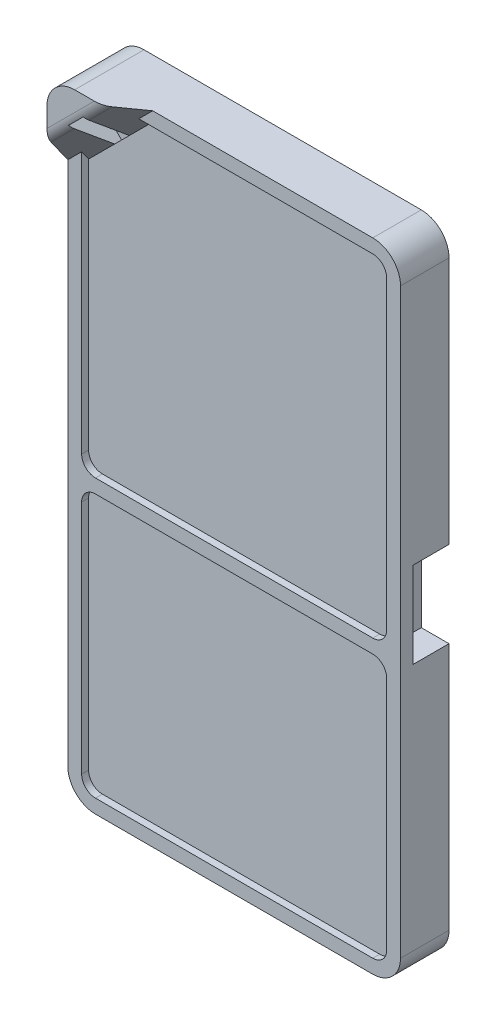
from build123d import *

# Parameters (mm, degrees)
BASE_DEPTH                = 3
CORNER_MARK_DEPTH         = 4.5
CORNER_MARK_DEPTH_BACK    = 4.5
CORNER_SKETCH_3_W         = 2
CORNER_SKETCH_3_H         = 0.5
CORNER_MARK_CUTOUT_DEPTH  = 0.75
CORNER_FIT_CUT_DEPTH      = 32.616432581
CORNER_FIT_CUT_DEPTH_BACK = 32.616432581
BORDER_START              = -3
BORDER_DEPTH              = 3.5
BODY_MIRROR_START         = -3
BODY_MIRROR_DEPTH         = 3
BODY_MIRROR_2_DEPTH       = 0.5
MAGNET_CUTOUT_SKETCH_W    = 2.6
MAGNET_CUTOUT_SKETCH_H    = 6.2
MAGNET_CUTOUT_DEPTH       = 2


with BuildPart() as part:
    # base_sketch → base (new body)
    with BuildSketch(Plane.XY):
        with BuildLine():
            ThreePointArc((-10, 0), (-10.707106781, 0.292893219), (-11, 1))
            Line((-11, 1), (-11, 23))
            ThreePointArc((-11, 23), (-10.707106781, 23.707106781), (-10, 24))
            Line((-10, 24), (0, 24))
            Line((0, 24), (0, 0))
            Line((0, 0), (-10, 0))
        make_face()
        with BuildLine():
            Line((0, -1), (-10, -1))
            ThreePointArc((-10, -1), (-10.707106781, -1.292893219), (-11, -2))
            Line((-11, -2), (-11, -19))
            ThreePointArc((-11, -19), (-10.707106781, -19.707106781), (-10, -20))
            Line((-10, -20), (0, -20))
            Line((0, -20), (0, -1))
        make_face()
        with BuildLine():
            Line((-10, 0), (0, 0))
            Line((0, 0), (0, -1))
            Line((0, -1), (-10, -1))
            ThreePointArc((-10, -1), (-10.707106781, -1.292893219), (-11, -2))
            Line((-11, -2), (-11, -19))
            ThreePointArc((-11, -19), (-10.707106781, -19.707106781), (-10, -20))
            Line((-10, -20), (0, -20))
            Line((0, -20), (0, -21))
            Line((0, -21), (-10, -21))
            ThreePointArc((-10, -21), (-11.414213562, -20.414213562), (-12, -19))
            Line((-12, -19), (-12, 23))
            ThreePointArc((-12, 23), (-11.414213562, 24.414213562), (-10, 25))
            Line((-10, 25), (0, 25))
            Line((0, 25), (0, 24))
            Line((0, 24), (-10, 24))
            ThreePointArc((-10, 24), (-10.707106781, 23.707106781), (-11, 23))
            Line((-11, 23), (-11, 1))
            ThreePointArc((-11, 1), (-10.707106781, 0.292893219), (-10, 0))
        make_face()
    extrude(amount=-BASE_DEPTH)

    # corner_sketch → corner_mark (add, two sides: drawn at the far end of the back side and taken through both)
    with BuildSketch(Plane(origin=(6.5, 6.5, 0), x_dir=(0.7071067811865477, -0.7071067811865475, 0), z_dir=(0.7071067811865475, 0.7071067811865477, 0)).offset(-CORNER_MARK_DEPTH_BACK)):
        with BuildLine():
            Line((-23.334523779, 0), (-25.334523779, 0))
            Line((-25.334523779, 0), (-25.334523779, -2))
            Line((-25.334523779, -2), (-23.748737342, -2))
            ThreePointArc((-23.748737342, -2), (-23.536817216, -1.97728699), (-23.334523779, -1.910179721))
            Line((-23.334523779, -1.910179721), (-23.334523779, 0))
        make_face()
        with BuildLine():
            Line((-21.334523779, 0), (-23.334523779, 0))
            Line((-23.334523779, 0), (-23.334523779, -1.910179721))
            ThreePointArc((-23.334523779, -1.910179721), (-23.178957136, -1.821797126), (-23.04163056, -1.707106781))
            Line((-23.04163056, -1.707106781), (-21.334523779, 0))
        make_face()
    extrude(amount=CORNER_MARK_DEPTH + CORNER_MARK_DEPTH_BACK)

    # corner_sketch<3> → corner_mark_cutout (cut, symmetric)
    with BuildSketch(Plane(origin=(6.5, 6.5, 0), x_dir=(0.7071067811865477, -0.7071067811865475, 0), z_dir=(0.7071067811865475, 0.7071067811865477, 0))):
        with BuildLine():
            Line((-21.334523779, 0), (-23.334523779, 0))
            Line((-23.334523779, 0), (-23.334523779, -1.910179721))
            ThreePointArc((-23.334523779, -1.910179721), (-23.178957136, -1.821797126), (-23.04163056, -1.707106781))
            Line((-23.04163056, -1.707106781), (-21.334523779, 0))
        make_face()
        with Locations((-22.334523779, 0.25)):
            Rectangle(CORNER_SKETCH_3_W, CORNER_SKETCH_3_H)
    extrude(amount=CORNER_MARK_CUTOUT_DEPTH, both=True, mode=Mode.SUBTRACT)

    # Эскиз3 → corner_fit_cut (cut, two sides: drawn at the far end of the back side and taken through both)
    with BuildSketch(Plane(origin=(0, 0, -3), x_dir=(-1, 0, 0), z_dir=(0, 0, -1)).offset(-CORNER_FIT_CUT_DEPTH_BACK)):
        with BuildLine():
            Line((10, 25), (4.949214827, 25))
            Line((4.949214827, 25), (4.949214827, 29.369186308))
            Line((4.949214827, 29.369186308), (15.830436382, 29.369186308))
            Line((15.830436382, 29.369186308), (15.830436382, 18.313069579))
            Line((15.830436382, 18.313069579), (12, 18.313069579))
            Line((12, 18.313069579), (12, 23))
            ThreePointArc((12, 23), (11.414213562, 24.414213562), (10, 25))
        make_face()
    extrude(amount=CORNER_FIT_CUT_DEPTH + CORNER_FIT_CUT_DEPTH_BACK, mode=Mode.SUBTRACT)

    # border: read off the stored shape, not the designer's step
    # border outline → border (add)
    with BuildSketch(Plane.XY.offset(BORDER_START)):
        Polygon((0, 24), (0, 25), (-5.878679656, 25), (-6.878679656, 24), align=None)
        with BuildLine():
            ThreePointArc((-10, 0), (-10.707106781, 0.292893219), (-11, 1))
            Line((-11, 1), (-11, 19.878679656))
            Line((-11, 19.878679656), (-12, 18.878679656))
            Line((-12, 18.878679656), (-12, -19))
            ThreePointArc((-12, -19), (-11.414213562, -20.414213562), (-10, -21))
            Line((-10, -21), (0, -21))
            Line((0, -21), (0, -20))
            Line((0, -20), (-10, -20))
            ThreePointArc((-10, -20), (-10.707106781, -19.707106781), (-11, -19))
            Line((-11, -19), (-11, -2))
            ThreePointArc((-11, -2), (-10.707106781, -1.292893219), (-10, -1))
            Line((-10, -1), (0, -1))
            Line((0, -1), (0, 0))
            Line((0, 0), (-10, 0))
        make_face()
    extrude(amount=BORDER_DEPTH)

    # body_mirror: read off the stored shape, not the designer's step
    # body_mirror outline → body_mirror (add)
    with BuildSketch(Plane.XY.offset(BODY_MIRROR_START)):
        with BuildLine():
            Line((0, -21), (10, -21))
            ThreePointArc((10, -21), (11.414213562, -20.414213562), (12, -19))
            Line((12, -19), (12, 23))
            ThreePointArc((12, 23), (11.414213562, 24.414213562), (10, 25))
            Line((10, 25), (0, 25))
            Line((0, 25), (0, -21))
        make_face()
    extrude(amount=BODY_MIRROR_DEPTH)

    # body_mirror 2 outline → body_mirror 2 (add)
    with BuildSketch(Plane.XY):
        with BuildLine():
            Line((0, -20), (0, -21))
            Line((0, -21), (10, -21))
            ThreePointArc((10, -21), (11.414213562, -20.414213562), (12, -19))
            Line((12, -19), (12, 23))
            ThreePointArc((12, 23), (11.414213562, 24.414213562), (10, 25))
            Line((10, 25), (0, 25))
            Line((0, 25), (0, 24))
            Line((0, 24), (10, 24))
            ThreePointArc((10, 24), (10.707106781, 23.707106781), (11, 23))
            Line((11, 23), (11, 1))
            ThreePointArc((11, 1), (10.707106781, 0.292893219), (10, 0))
            Line((10, 0), (0, 0))
            Line((0, 0), (0, -1))
            Line((0, -1), (10, -1))
            ThreePointArc((10, -1), (10.707106781, -1.292893219), (11, -2))
            Line((11, -2), (11, -19))
            ThreePointArc((11, -19), (10.707106781, -19.707106781), (10, -20))
            Line((10, -20), (0, -20))
        make_face()
    extrude(amount=BODY_MIRROR_2_DEPTH)

    # magnet_cutout_sketch → magnet_cutout (cut)
    with BuildSketch(Plane(origin=(12, 0, 0), x_dir=(0, 0, -1), z_dir=(1, 0, 0))):
        with Locations((1.7, 2)):
            Rectangle(MAGNET_CUTOUT_SKETCH_W, MAGNET_CUTOUT_SKETCH_H)
    magnet_cutout = extrude(amount=-MAGNET_CUTOUT_DEPTH, mode=Mode.SUBTRACT)

    # magnet_cutout_mirror: magnet_cutout across plane
    add(magnet_cutout.mirror(Plane(origin=(0, 0, 0), x_dir=(0, 0, 1), z_dir=(1, 0, 0))), mode=Mode.SUBTRACT)


solid = part.part
